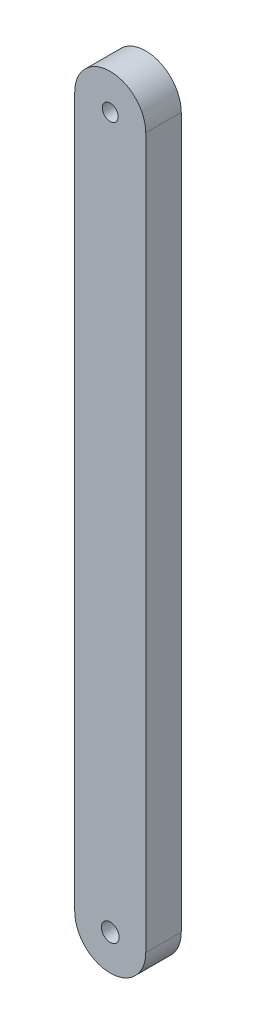
from build123d import *

# Parameters (mm, degrees)
SKETCH1_R             = 2.5
BOSS_EXTRUDE1_DEPTH   = 10
BODY_MOVE_COPY1_ANGLE = 90


with BuildPart() as part:
    # Sketch1 → Boss-Extrude1 (new body)
    with BuildSketch(Plane(origin=(0, 0, 0), x_dir=(1, 0, 0), z_dir=(0, 1, 0))):
        with BuildLine():
            ThreePointArc((-10, -100), (0, -110), (10, -100))
            Line((10, -100), (10, 100))
            ThreePointArc((10, 100), (0, 110), (-10, 100))
            Line((-10, 100), (-10, -100))
        make_face()
        with Locations((0, -100)):
            Circle(SKETCH1_R, mode=Mode.SUBTRACT)
        with BuildLine():
            ThreePointArc((1.5875, 98.4125), (0, 97.75493597), (-1.5875, 98.4125))
            ThreePointArc((-1.5875, 98.4125), (-2.24506403, 100), (-1.5875, 101.5875))
            ThreePointArc((-1.5875, 101.5875), (0, 102.24506403), (1.5875, 101.5875))
            ThreePointArc((1.5875, 101.5875), (2.074168707, 100.859148809), (2.24506403, 100))
            ThreePointArc((2.24506403, 100), (2.074168707, 99.140851191), (1.5875, 98.4125))
        make_face(mode=Mode.SUBTRACT)
    extrude(amount=BOSS_EXTRUDE1_DEPTH)


with BuildPart() as part_1:
    # Body-Move/Copy1: moved
    add(part.part.rotate(Axis((0, 5, 0), (1, 0, 0)), BODY_MOVE_COPY1_ANGLE))


solid = part_1.part
